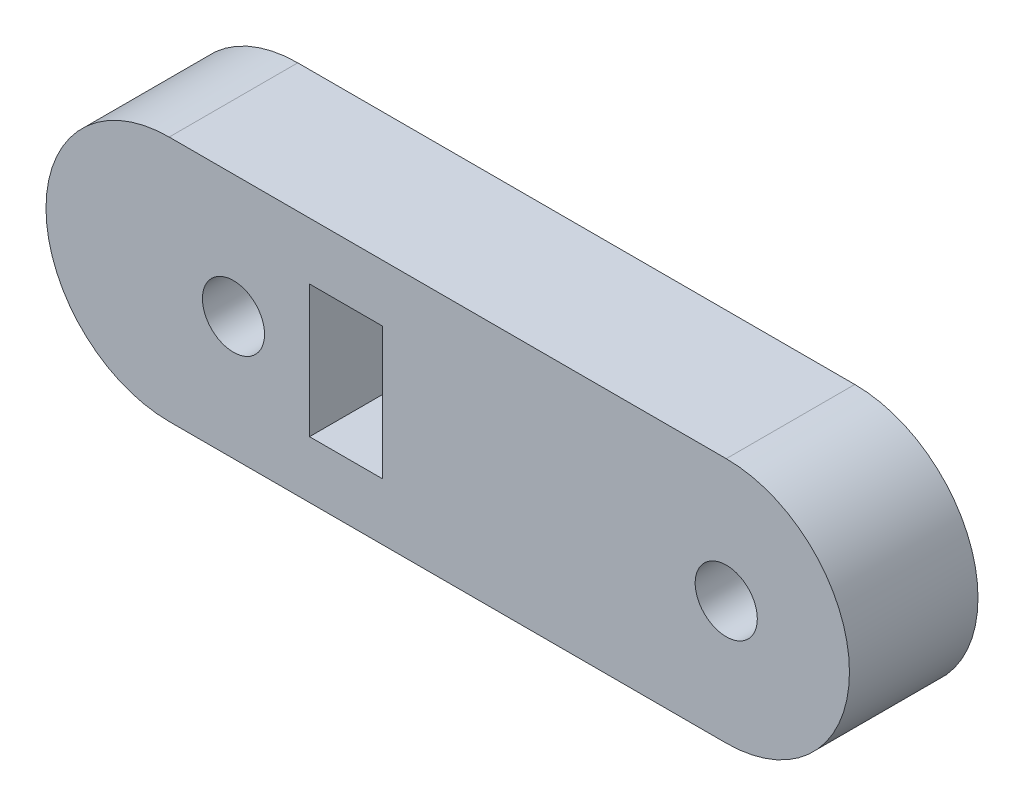
from build123d import *

# Parameters (mm, degrees)
SKETCH1_R           = 1.45
SKETCH1_W           = 3.400011
SKETCH1_H           = 6.173462
BOSS_EXTRUDE1_DEPTH = 6


with BuildPart() as part:
    # Sketch1 → Boss-Extrude1 (new body)
    with BuildSketch(Plane.XY):
        with BuildLine():
            Line((589.771388, 466.232899), (612.771388, 466.232899))
            ThreePointArc((612.771388, 466.232899), (618.521388, 460.482899), (612.771388, 454.732899))
            Line((612.771388, 454.732899), (589.771388, 454.732899))
            Line((589.771388, 454.732899), (586.771388, 454.732899))
            ThreePointArc((586.771388, 454.732899), (581.021388, 460.482899), (586.771388, 466.232899))
            Line((586.771388, 466.232899), (589.771388, 466.232899))
        make_face()
        with Locations((589.771388, 460.482899)):
            Circle(SKETCH1_R, mode=Mode.SUBTRACT)
        with Locations((612.771388, 460.482899)):
            Circle(SKETCH1_R, mode=Mode.SUBTRACT)
        with Locations((595.0213935, 460.482899)):
            Rectangle(SKETCH1_W, SKETCH1_H, mode=Mode.SUBTRACT)
    extrude(amount=BOSS_EXTRUDE1_DEPTH)


solid = part.part
